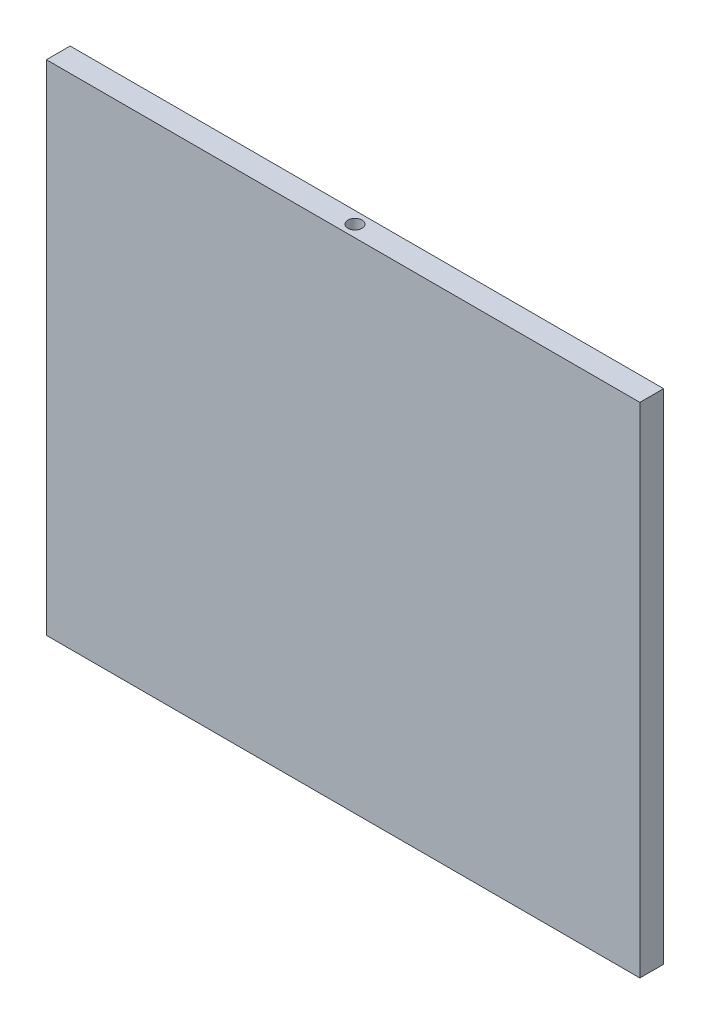
from build123d import *

# Parameters (mm, degrees)
ESQUISSE1_W                  = 250
ESQUISSE1_H                  = 210
BOSS_EXTRU_1_DEPTH           = 10
ENL_V_MAT_EXTRU_1_DEPTH      = 245.591496173
ENL_V_MAT_EXTRU_1_DEPTH_BACK = 245.591496173
ESQUISSE2_R                  = 3


with BuildPart() as part:
    # Esquisse1 → Boss.-Extru.1 (new body)
    with BuildSketch(Plane.XY):
        Rectangle(ESQUISSE1_W, ESQUISSE1_H)
    extrude(amount=BOSS_EXTRU_1_DEPTH)

    # Esquisse2 → Enlèv. mat.-Extru.1 (cut, two sides: drawn at the far end of the back side and taken through both)
    with BuildSketch(Plane(origin=(0, 105, 0), x_dir=(1, 0, 0), z_dir=(0, 1, 0)).offset(-ENL_V_MAT_EXTRU_1_DEPTH_BACK)):
        with Locations((0, -5)):
            Circle(ESQUISSE2_R)
    extrude(amount=ENL_V_MAT_EXTRU_1_DEPTH + ENL_V_MAT_EXTRU_1_DEPTH_BACK, mode=Mode.SUBTRACT)


solid = part.part
